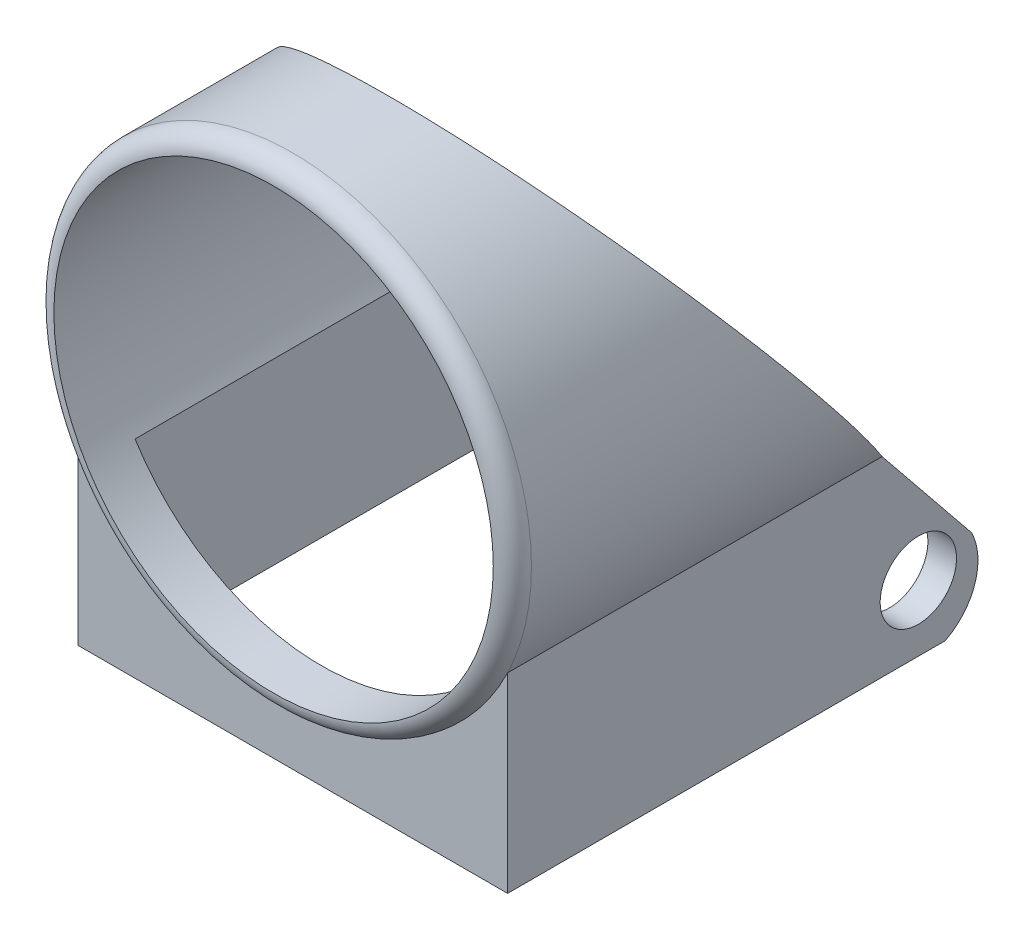
from build123d import *

# Parameters (mm, degrees)
EXTRUDE_1_DEPTH      = 50
SHELL_2_T            = -3
SKETCH_13_R          = 4
CUT_EXTRUDE_1_DEPTH  = 250
SKETCH_18_R          = 25
EXTRUDE_4_DEPTH      = 2
SKETCH_19_R          = 9.153493009
CUT_EXTRUDE_10_DEPTH = 65.852487738
SKETCH_16_R          = 25
EXTRUDE_3_DEPTH      = 2
SKETCH_17_R          = 23
CUT_EXTRUDE_9_DEPTH  = 65.852487738


with BuildPart() as part:
    # 草图1 → 凸台-拉伸1 (new body)
    with BuildSketch(Plane.XY):
        with BuildLine():
            Line((-22.5, -10.897247359), (-22.5, -30.897247359))
            Line((-22.5, -30.897247359), (22.5, -30.897247359))
            Line((22.5, -30.897247359), (22.5, -10.897247359))
            ThreePointArc((22.5, -10.897247359), (0, 25), (-22.5, -10.897247359))
        make_face()
    extrude(amount=EXTRUDE_1_DEPTH)

    # 抽壳2
    shell_2_openings = [part.faces().sort_by_distance(p)[0] for p in [
        (0, -4.655282496, 0),
        (0, -30.897247359, 25),
    ]]
    offset(amount=SHELL_2_T, openings=shell_2_openings, kind=Kind.INTERSECTION)

    # 草图13 → 切除-拉伸1 (cut, symmetric)
    with BuildSketch(Plane(origin=(0, 0, 0), x_dir=(0, 0, -1), z_dir=(1, 0, 0))):
        with Locations(Location((-7, -24, 0), (0, 0, 180))):
            Circle(SKETCH_13_R)
        with BuildLine():
            Line((-40, 25.208572912), (-1.432281326, -22.471249301))
            ThreePointArc((-1.432281326, -22.471249301), (-1.063231061, -27.254219062), (-4.184343468, -30.897247359))
            Line((-4.184343468, -30.897247359), (0, -30.897247359))
            Line((0, -30.897247359), (0, 25.208572912))
            Line((0, 25.208572912), (-40, 25.208572912))
        make_face()
    extrude(amount=CUT_EXTRUDE_1_DEPTH, both=True, mode=Mode.SUBTRACT)

    # 草图18 → 凸台-拉伸4 (add)
    with BuildSketch(Plane.XY.offset(50)):
        with Locations(Location((0, 0, 0), (0, 0, 205.841932763))):
            Circle(SKETCH_18_R)
    extrude(amount=EXTRUDE_4_DEPTH)

    # 圆角3: read off the stored shape, not the designer's step
    # 圆角3 outline → 圆角3 (revolve, cut)
    with BuildSketch(Plane.XZ):
        with BuildLine():
            ThreePointArc((23, 52), (24.414213562, 51.414213562), (25, 50))
            Line((25, 50), (25, 52))
            Line((25, 52), (23, 52))
        make_face()
    revolve(axis=Axis((0, 0, 0), (0, 0, 1)), mode=Mode.SUBTRACT)

    # 草图19 → 切除-拉伸10 (cut, through all)
    with BuildSketch(Plane.XY.offset(52)):
        Circle(SKETCH_19_R)
    extrude(amount=-CUT_EXTRUDE_10_DEPTH, mode=Mode.SUBTRACT)

    # 草图16 → 凸台-拉伸3 (add)
    with BuildSketch(Plane.XY.offset(50)):
        with Locations(Location((0, 0, 0), (0, 0, 205.841932763))):
            Circle(SKETCH_16_R)
    extrude(amount=EXTRUDE_3_DEPTH)

    # 圆角2: read off the stored shape, not the designer's step
    # 圆角2 outline → 圆角2 (revolve, cut)
    with BuildSketch(Plane.XZ):
        with BuildLine():
            ThreePointArc((23, 52), (24.414213562, 51.414213562), (25, 50))
            Line((25, 50), (25, 52))
            Line((25, 52), (23, 52))
        make_face()
    revolve(axis=Axis((0, 0, 0), (0, 0, 1)), mode=Mode.SUBTRACT)

    # 草图17 → 切除-拉伸9 (cut, through all)
    with BuildSketch(Plane.XY.offset(52)):
        Circle(SKETCH_17_R)
    extrude(amount=-CUT_EXTRUDE_9_DEPTH, mode=Mode.SUBTRACT)


solid = part.part
